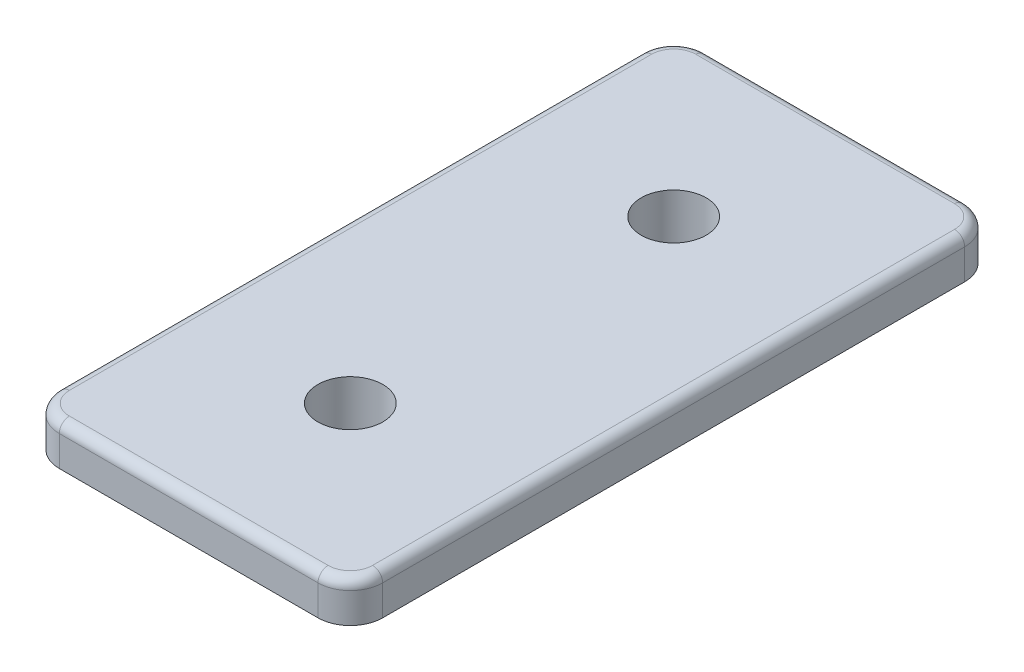
from build123d import *

# Parameters (mm, degrees)
SKETCH1_W           = 21.717
SKETCH1_H           = 47.117
BOSS_EXTRUDE1_DEPTH = 0.762
SKETCH2_W           = 25.4
SKETCH2_H           = 50.8
BOSS_EXTRUDE2_DEPTH = 3.175
SKETCH3_R           = 2.5527
CUT_EXTRUDE1_DEPTH  = 29.669669845
FILLET1_R           = 2.54
FILLET3_R           = 0.79375


with BuildPart() as part:
    # Sketch1 → Boss-Extrude1 (new body)
    with BuildSketch(Plane(origin=(0, 0, 0), x_dir=(1, 0, 0), z_dir=(0, 1, 0))):
        Rectangle(SKETCH1_W, SKETCH1_H)
    extrude(amount=BOSS_EXTRUDE1_DEPTH)

    # Sketch2 → Boss-Extrude2 (add)
    with BuildSketch(Plane(origin=(0, 0.762, 0), x_dir=(1, 0, 0), z_dir=(0, 1, 0))):
        Rectangle(SKETCH2_W, SKETCH2_H)
    extrude(amount=BOSS_EXTRUDE2_DEPTH)

    # Sketch3 → Cut-Extrude1 (cut, through all)
    with BuildSketch(Plane(origin=(0, 3.937, 0), x_dir=(1, 0, 0), z_dir=(0, 1, 0))):
        with Locations((0, 12.7)):
            Circle(SKETCH3_R)
        with Locations((0, -12.7)):
            Circle(SKETCH3_R)
    extrude(amount=-CUT_EXTRUDE1_DEPTH, mode=Mode.SUBTRACT)

    # Fillet1
    fillet1_edges = [part.edges().sort_by_distance(p)[0] for p in [
        (-10.8585, 0.381, 23.5585),
        (10.8585, 0.381, 23.5585),
        (-10.8585, 0.381, -23.5585),
        (10.8585, 0.381, -23.5585),
        (12.7, 2.3495, -25.4),
        (12.7, 2.3495, 25.4),
        (-12.7, 2.3495, -25.4),
        (-12.7, 2.3495, 25.4),
    ]]
    fillet(fillet1_edges, radius=FILLET1_R)

    # Fillet3
    fillet3_edges = [part.edges().sort_by_distance(p)[0] for p in [
        (-11.956051224, 3.937, -24.656051224),
        (0, 3.937, -25.4),
        (11.956051224, 3.937, -24.656051224),
        (12.7, 3.937, 0),
        (11.956051224, 3.937, 24.656051224),
        (0, 3.937, 25.4),
        (-11.956051224, 3.937, 24.656051224),
        (-12.7, 3.937, 0),
    ]]
    fillet(fillet3_edges, radius=FILLET3_R)


solid = part.part
